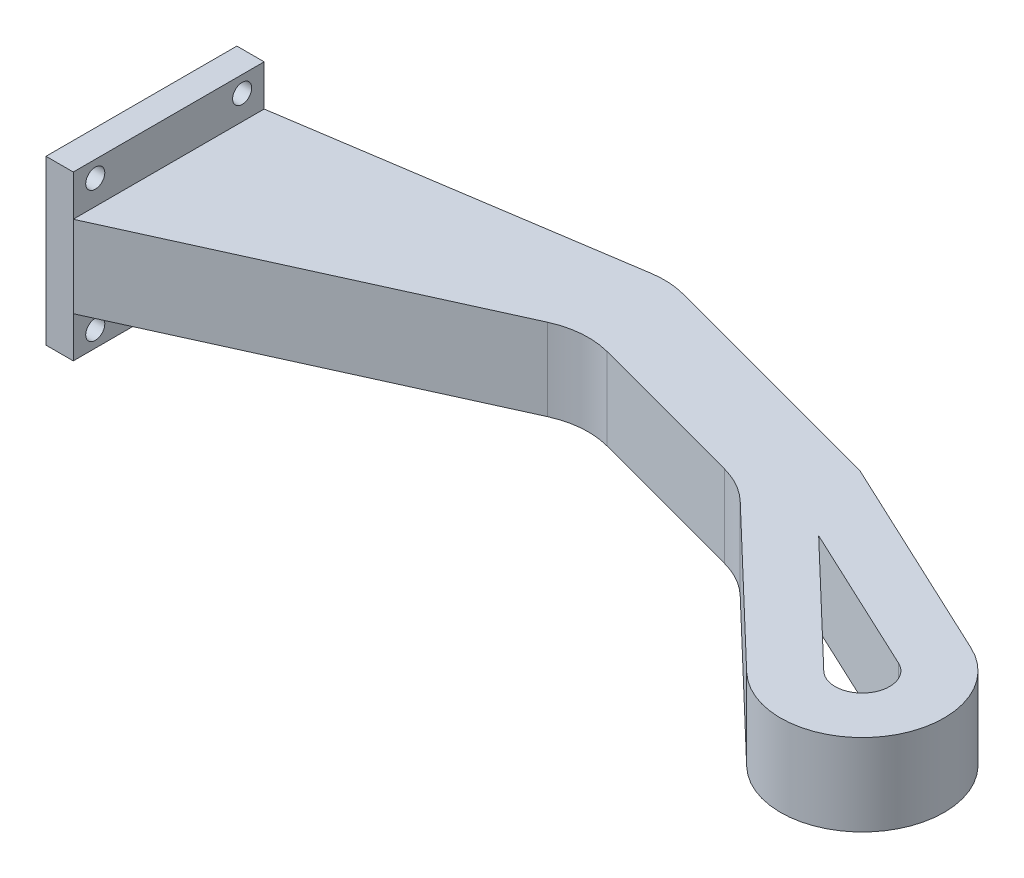
from build123d import *

# Parameters (mm, degrees)
SKETCH1_W           = 35
SKETCH1_H           = 30
BOSS_EXTRUDE1_DEPTH = 5
EXTRUDE_THIN1_START = -7.5
EXTRUDE_THIN1_DEPTH = 15
FILLET1_R           = 15
SKETCH3_R           = 1.75
CUT_EXTRUDE1_DEPTH  = 15


# Read off the part's stored shape, not the designer's step: Extrude-Thin1
with BuildPart() as part:
    # Sketch1 → Boss-Extrude1 (new body)
    with BuildSketch(Plane(origin=(0, 0, 0), x_dir=(0, 0, -1), z_dir=(1, 0, 0))):
        Rectangle(SKETCH1_W, SKETCH1_H)
    extrude(amount=BOSS_EXTRUDE1_DEPTH)

    # Sketch3 → Cut-Extrude1 (cut)
    with BuildSketch(Plane.ZY):
        with Locations((-13.47, 12)):
            Circle(SKETCH3_R)
        with Locations((-13.47, -12)):
            Circle(SKETCH3_R)
        with Locations((13.47, -12)):
            Circle(SKETCH3_R)
        with Locations((13.47, 12)):
            Circle(SKETCH3_R)
    extrude(amount=-CUT_EXTRUDE1_DEPTH, mode=Mode.SUBTRACT)


with BuildPart() as body_2:
    # Extrude-Thin1 outline → Extrude-Thin1 (new body)
    with BuildSketch(Plane(origin=(0, 0, 0), x_dir=(1, 0, 0), z_dir=(0, 1, 0)).offset(EXTRUDE_THIN1_START)):
        with BuildLine():
            Line((5, 17.5), (5, -17.5))
            Line((5, -17.5), (69.699704629, 11.836309819))
            Line((69.699704629, 11.836309819), (108.138274173, 1.533178197))
            Line((108.138274173, 1.533178197), (138.676277548, -27.700290017))
            ThreePointArc((138.676277548, -27.700290017), (161.421833774, -25.344805337), (155.412254056, -3.281406058))
            Line((155.412254056, -3.281406058), (117.129901337, 14.652550121))
            Line((117.129901337, 14.652550121), (69.699704629, 27.365810926))
            Line((69.699704629, 27.365810926), (5, 17.5))
        make_face()
        with BuildLine():
            ThreePointArc((151.170028648, -12.336985752), (153.173221887, -19.691452178), (145.591369812, -20.476613738))
            Line((145.591369812, -20.476613738), (123.593252888, 0.581778455))
            Line((123.593252888, 0.581778455), (151.170028648, -12.336985752))
        make_face(mode=Mode.SUBTRACT)
    extrude(amount=EXTRUDE_THIN1_DEPTH)

    # Fillet1
    fillet1_edges = [body_2.edges().sort_by_distance(p)[0] for p in [
        (69.699704629, 0, -27.365810926),
        (108.138274173, 0, -1.533178197),
        (69.699704629, 0, -11.836309819),
    ]]
    fillet(fillet1_edges, radius=FILLET1_R)


solid = Compound([part.part, body_2.part])
